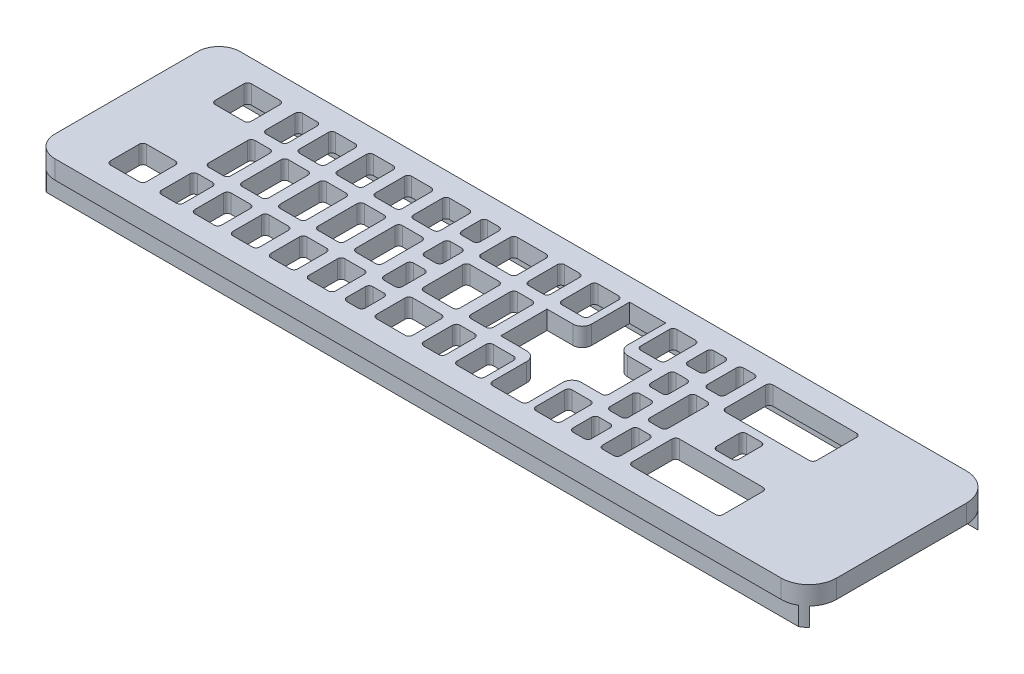
from build123d import *

# Parameters (mm, degrees)
SKETCH1_W               = 218.44
SKETCH1_H               = 50.8
BOSS_EXTRUDE1_DEPTH     = 5.08
SKETCH2_W               = 216.408
SKETCH2_H               = 48.768
BOSS_EXTRUDE2_DEPTH     = 5.08
SKETCH3_W               = 213.868
SKETCH3_H               = 46.228
CUT_EXTRUDE1_DEPTH      = 5.08
FILLET1_R               = 2.54
SKETCH4_W               = 9.906
SKETCH4_H               = 9.906
SKETCH4_W_2             = 6.096
SKETCH4_H_2             = 12.7
SKETCH4_W_3             = 7.366
SKETCH4_W_4             = 5.08
SKETCH4_H_3             = 7.112
SKETCH4_H_4             = 8.128
SKETCH4_W_5             = 7.62
SKETCH4_W_6             = 7.112
SKETCH4_W_7             = 5.0038
SKETCH4_H_5             = 6.828713061
SKETCH4_W_8             = 24.9174
SKETCH4_H_6             = 12.954
SKETCH4_H_7             = 8.141940284
CUT_EXTRUDE2_DEPTH      = 113.593934117
FILLET2_R               = 2.54
FILLET3_R               = 1.016
FILLET4_R               = 1.016
FILLET5_R               = 1.016
FILLET6_R               = 1.016
FILLET7_R               = 1.016
FILLET8_R               = 2.54
CUT_EXTRUDE7_DEPTH      = 113.249609353
CUT_EXTRUDE7_DEPTH_BACK = 113.249609353
SKETCH6_W               = 5.442052388
SKETCH6_H               = 50.8
FILLET11_R              = 7.62
CUT_EXTRUDE8_DEPTH      = 113.249609353
CUT_EXTRUDE8_DEPTH_BACK = 113.249609353
SKETCH7_W               = 1.016
SKETCH7_H               = 10.16
FILLET16_R              = 5.842


with BuildPart() as part:
    # Sketch1 → Boss-Extrude1 (new body)
    with BuildSketch(Plane(origin=(0, 0, 0), x_dir=(1, 0, 0), z_dir=(0, 1, 0))):
        Rectangle(SKETCH1_W, SKETCH1_H)
    extrude(amount=BOSS_EXTRUDE1_DEPTH)

    # Sketch2 → Boss-Extrude2 (add)
    with BuildSketch(Plane.XZ):
        Rectangle(SKETCH2_W, SKETCH2_H)
    extrude(amount=BOSS_EXTRUDE2_DEPTH)

    # Sketch3 → Cut-Extrude1 (cut)
    with BuildSketch(Plane.XZ.offset(5.08)):
        Rectangle(SKETCH3_W, SKETCH3_H)
    extrude(amount=-CUT_EXTRUDE1_DEPTH, mode=Mode.SUBTRACT)

    # Fillet1
    fillet1_edges = [part.edges().sort_by_distance(p)[0] for p in [
        (-108.204, -2.54, 24.384),
        (-108.204, -2.54, -24.384),
        (108.204, -2.54, 24.384),
        (106.934, -2.54, -23.114),
        (-109.22, 2.54, -25.4),
        (109.22, 2.54, -25.4),
        (109.22, 2.54, 25.4),
        (-109.22, 2.54, 25.4),
    ]]
    fillet(fillet1_edges, radius=FILLET1_R)

    # Sketch4 → Cut-Extrude2 (cut, through all)
    with BuildSketch(Plane(origin=(0, 5.08, 0), x_dir=(1, 0, 0), z_dir=(0, 1, 0))):
        with Locations((-89.281, -14.351)):
            Rectangle(SKETCH4_W, SKETCH4_H)
        with Locations((-89.281, 14.351)):
            Rectangle(SKETCH4_W, SKETCH4_H)
        with Locations((-77.216, 14.351)):
            Rectangle(SKETCH4_W_2, SKETCH4_H)
        with Locations((-77.216, 0)):
            Rectangle(SKETCH4_W_2, SKETCH4_H_2)
        with Locations((-77.216, -14.351)):
            Rectangle(SKETCH4_W_2, SKETCH4_H)
        with Locations((-67.437, -14.351)):
            Rectangle(SKETCH4_W_3, SKETCH4_H)
        with Locations((-67.437, 0)):
            Rectangle(SKETCH4_W_3, SKETCH4_H_2)
        with Locations((-67.437, 14.351)):
            Rectangle(SKETCH4_W_3, SKETCH4_H)
        with Locations((-57.023, 14.351)):
            Rectangle(SKETCH4_W_3, SKETCH4_H)
        with Locations((-57.023, 0)):
            Rectangle(SKETCH4_W_3, SKETCH4_H_2)
        with Locations((-57.023, -14.351)):
            Rectangle(SKETCH4_W_3, SKETCH4_H)
        with Locations((-46.609, 0)):
            Rectangle(SKETCH4_W_3, SKETCH4_H_2)
        with Locations((-46.609, 14.351)):
            Rectangle(SKETCH4_W_3, SKETCH4_H)
        with Locations((-46.609, -14.351)):
            Rectangle(SKETCH4_W_3, SKETCH4_H)
        with Locations((-36.195, -14.351)):
            Rectangle(SKETCH4_W_3, SKETCH4_H)
        with Locations((-36.195, 0)):
            Rectangle(SKETCH4_W_3, SKETCH4_H_2)
        with Locations((-36.195, 14.351)):
            Rectangle(SKETCH4_W_3, SKETCH4_H)
        with Locations((-26.924, 15.748)):
            Rectangle(SKETCH4_W_4, SKETCH4_H_3)
        with Locations((-26.924, 5.588)):
            Rectangle(SKETCH4_W_4, SKETCH4_H_3)
        with Locations((-26.924, -5.08)):
            Rectangle(SKETCH4_W_4, SKETCH4_H_4)
        with Locations((-26.924, -15.748)):
            Rectangle(SKETCH4_W_4, SKETCH4_H_3)
        with Locations((-16.383, 14.351)):
            Rectangle(SKETCH4_W, SKETCH4_H)
        with Locations((-5.334, 14.351)):
            Rectangle(SKETCH4_W_2, SKETCH4_H)
        with Locations((-16.383, 0)):
            Rectangle(SKETCH4_W, SKETCH4_H_2)
        with Locations((-5.334, 0)):
            Rectangle(SKETCH4_W_2, SKETCH4_H_2)
        with Locations((-16.383, -14.351)):
            Rectangle(SKETCH4_W, SKETCH4_H)
        with Locations((-5.334, -14.351)):
            Rectangle(SKETCH4_W_2, SKETCH4_H)
        with Locations((4.572, -14.351)):
            Rectangle(SKETCH4_W_5, SKETCH4_H)
        with BuildLine():
            Line((10.414, -6.35), (8.382, -6.35))
            Line((8.382, -6.35), (0.762, -6.35))
            Line((0.762, -6.35), (0.762, 6.35))
            Line((0.762, 6.35), (8.382, 6.35))
            Line((8.382, 6.35), (10.414, 6.35))
            Line((10.414, 6.35), (10.414, 19.304))
            Line((10.414, 19.304), (20.32, 19.304))
            Line((20.32, 19.304), (20.32, 8.89))
            ThreePointArc((20.32, 8.89), (21.063948776, 7.093948776), (22.86, 6.35))
            Line((22.86, 6.35), (29.464, 6.35))
            Line((29.464, 6.35), (29.464, -6.35))
            Line((29.464, -6.35), (22.86, -6.35))
            ThreePointArc((22.86, -6.35), (21.063948776, -7.093948776), (20.32, -8.89))
            Line((20.32, -8.89), (20.32, -19.304))
            Line((20.32, -19.304), (10.414, -19.304))
            Line((10.414, -19.304), (10.414, -6.35))
        make_face()
        with Locations((4.572, 14.351)):
            Rectangle(SKETCH4_W_5, SKETCH4_H)
        with Locations((25.908, 14.351)):
            Rectangle(SKETCH4_W_6, SKETCH4_H)
        with Locations((35.052, 15.748)):
            Rectangle(SKETCH4_W_4, SKETCH4_H_3)
        with Locations((43.1419, 14.351)):
            Rectangle(SKETCH4_W_7, SKETCH4_H)
        with Locations((43.1419, 0)):
            Rectangle(SKETCH4_W_7, SKETCH4_H_2)
        with Locations((35.052, -5.08)):
            Rectangle(SKETCH4_W_4, SKETCH4_H_4)
        with Locations((35.052, 5.446356531)):
            Rectangle(SKETCH4_W_4, SKETCH4_H_5)
        with Locations((25.908, -14.351)):
            Rectangle(SKETCH4_W_6, SKETCH4_H)
        with Locations((35.052, -15.748)):
            Rectangle(SKETCH4_W_4, SKETCH4_H_3)
        with Locations((43.1419, -14.351)):
            Rectangle(SKETCH4_W_7, SKETCH4_H)
        with Locations((61.1505, -12.827)):
            Rectangle(SKETCH4_W_8, SKETCH4_H_6)
        with Locations((59.6138, 0.08685337)):
            Rectangle(SKETCH4_W_2, SKETCH4_H_7)
        with Locations((61.1505, 12.827)):
            Rectangle(SKETCH4_W_8, SKETCH4_H_6)
    extrude(amount=-CUT_EXTRUDE2_DEPTH, mode=Mode.SUBTRACT)

    # Fillet2
    fillet2_edges = [part.edges().sort_by_distance(p)[0] for p in [
        (10.414, 2.54, 6.35),
        (10.414, 2.54, -6.35),
    ]]
    fillet(fillet2_edges, radius=FILLET2_R)

    # Fillet3
    fillet3_edges = [part.edges().sort_by_distance(p)[0] for p in [
        (48.6918, 2.54, -19.304),
        (73.6092, 2.54, -19.304),
        (73.6092, 2.54, -6.35),
        (48.6918, 2.54, -6.35),
        (48.6918, 2.54, 19.304),
        (48.6918, 2.54, 6.35),
        (73.6092, 2.54, 6.35),
        (73.6092, 2.54, 19.304),
        (56.5658, 2.54, -4.157823512),
        (62.6618, 2.54, -4.157823512),
        (62.6618, 2.54, 3.984116772),
        (56.5658, 2.54, 3.984116772),
    ]]
    fillet(fillet3_edges, radius=FILLET3_R)

    # Fillet4
    fillet4_edges = [part.edges().sort_by_distance(p)[0] for p in [
        (-53.34, 2.54, 6.35),
        (-53.34, 2.54, 19.304),
        (-42.926, 2.54, 6.35),
        (-42.926, 2.54, -9.398),
        (-42.926, 2.54, 19.304),
        (-32.512, 2.54, 19.304),
        (-32.512, 2.54, 6.35),
        (-32.512, 2.54, -9.398),
        (-53.34, 2.54, -9.398),
        (-63.754, 2.54, -9.398),
        (-63.754, 2.54, 6.35),
        (-63.754, 2.54, 19.304),
        (-74.168, 2.54, 19.304),
        (-74.168, 2.54, 6.35),
        (-74.168, 2.54, -9.398),
        (-84.328, 2.54, -9.398),
        (-11.43, 2.54, 19.304),
        (-2.286, 2.54, 19.304),
        (29.464, 2.54, 6.35),
        (20.32, 2.54, 19.304),
        (8.382, 2.54, 19.304),
        (8.382, 2.54, -9.398),
        (29.464, 2.54, -9.398),
        (37.592, 2.54, -12.192),
        (45.6438, 2.54, -9.398),
        (-2.286, 2.54, 6.35),
        (-11.43, 2.54, 6.35),
        (-2.286, 2.54, -9.398),
        (-11.43, 2.54, -9.398),
        (-24.384, 2.54, 19.304),
        (-24.384, 2.54, 9.144),
        (-24.384, 2.54, -2.032),
        (-24.384, 2.54, -12.192),
        (29.464, 2.54, 19.304),
        (37.592, 2.54, -2.032),
        (37.592, 2.54, 9.144),
        (45.6438, 2.54, 6.35),
        (37.592, 2.54, 19.304),
        (45.6438, 2.54, 19.304),
        (-84.328, 2.54, 19.304),
    ]]
    fillet(fillet4_edges, radius=FILLET4_R)

    # Fillet5
    fillet5_edges = [part.edges().sort_by_distance(p)[0] for p in [
        (-53.34, 2.54, -6.35),
        (-53.34, 2.54, 9.398),
        (-42.926, 2.54, -6.35),
        (-42.926, 2.54, -19.304),
        (-42.926, 2.54, 9.398),
        (-32.512, 2.54, 9.398),
        (-32.512, 2.54, -6.35),
        (-32.512, 2.54, -19.304),
        (-53.34, 2.54, -19.304),
        (-63.754, 2.54, -19.304),
        (-63.754, 2.54, -6.35),
        (-63.754, 2.54, 9.398),
        (-74.168, 2.54, 9.398),
        (-74.168, 2.54, -6.35),
        (-74.168, 2.54, -19.304),
        (-84.328, 2.54, -19.304),
        (-11.43, 2.54, 9.398),
        (-2.286, 2.54, 9.398),
        (8.382, 2.54, 9.398),
        (8.382, 2.54, -19.304),
        (29.464, 2.54, -19.304),
        (37.592, 2.54, -19.304),
        (45.6438, 2.54, -19.304),
        (-2.286, 2.54, -6.35),
        (-11.43, 2.54, -6.35),
        (-2.286, 2.54, -19.304),
        (-11.43, 2.54, -19.304),
        (-24.384, 2.54, 12.192),
        (-24.384, 2.54, 1.016),
        (-24.384, 2.54, -9.144),
        (-24.384, 2.54, -19.304),
        (29.464, 2.54, 9.398),
        (37.592, 2.54, -8.860713061),
        (37.592, 2.54, 1.016),
        (45.6438, 2.54, -6.35),
        (37.592, 2.54, 12.192),
        (45.6438, 2.54, 9.398),
        (-84.328, 2.54, 9.398),
    ]]
    fillet(fillet5_edges, radius=FILLET5_R)

    # Fillet6
    fillet6_edges = [part.edges().sort_by_distance(p)[0] for p in [
        (-60.706, 2.54, 6.35),
        (-60.706, 2.54, 19.304),
        (-50.292, 2.54, 6.35),
        (-50.292, 2.54, -9.398),
        (-50.292, 2.54, 19.304),
        (-39.878, 2.54, 19.304),
        (-39.878, 2.54, 6.35),
        (-39.878, 2.54, -9.398),
        (-60.706, 2.54, -9.398),
        (-71.12, 2.54, -9.398),
        (-71.12, 2.54, 6.35),
        (-71.12, 2.54, 19.304),
        (-80.264, 2.54, 19.304),
        (-80.264, 2.54, 6.35),
        (-80.264, 2.54, -9.398),
        (-94.234, 2.54, -9.398),
        (-21.336, 2.54, 19.304),
        (-8.382, 2.54, 19.304),
        (10.414, 2.54, 19.304),
        (0.762, 2.54, 19.304),
        (0.762, 2.54, -9.398),
        (22.352, 2.54, -9.398),
        (32.512, 2.54, -12.192),
        (40.64, 2.54, -9.398),
        (-8.382, 2.54, 6.35),
        (-21.336, 2.54, 6.35),
        (-8.382, 2.54, -9.398),
        (-21.336, 2.54, -9.398),
        (-29.464, 2.54, 19.304),
        (-29.464, 2.54, 9.144),
        (-29.464, 2.54, -2.032),
        (-29.464, 2.54, -12.192),
        (22.352, 2.54, 19.304),
        (32.512, 2.54, -2.032),
        (32.512, 2.54, 9.144),
        (40.64, 2.54, 6.35),
        (32.512, 2.54, 19.304),
        (40.64, 2.54, 19.304),
        (-94.234, 2.54, 19.304),
    ]]
    fillet(fillet6_edges, radius=FILLET6_R)

    # Fillet7
    fillet7_edges = [part.edges().sort_by_distance(p)[0] for p in [
        (-60.706, 2.54, -6.35),
        (-60.706, 2.54, 9.398),
        (-50.292, 2.54, -6.35),
        (-50.292, 2.54, -19.304),
        (-50.292, 2.54, 9.398),
        (-39.878, 2.54, 9.398),
        (-39.878, 2.54, -6.35),
        (-39.878, 2.54, -19.304),
        (-60.706, 2.54, -19.304),
        (-71.12, 2.54, -19.304),
        (-71.12, 2.54, -6.35),
        (-71.12, 2.54, 9.398),
        (-80.264, 2.54, 9.398),
        (-80.264, 2.54, -6.35),
        (-80.264, 2.54, -19.304),
        (-94.234, 2.54, -19.304),
        (-21.336, 2.54, 9.398),
        (-8.382, 2.54, 9.398),
        (0.762, 2.54, 9.398),
        (0.762, 2.54, -19.304),
        (22.352, 2.54, -19.304),
        (32.512, 2.54, -19.304),
        (40.64, 2.54, -19.304),
        (-8.382, 2.54, -6.35),
        (-21.336, 2.54, -6.35),
        (-8.382, 2.54, -19.304),
        (-21.336, 2.54, -19.304),
        (-29.464, 2.54, 12.192),
        (-29.464, 2.54, 1.016),
        (-29.464, 2.54, -9.144),
        (-29.464, 2.54, -19.304),
        (22.352, 2.54, 9.398),
        (32.512, 2.54, -8.860713061),
        (32.512, 2.54, 1.016),
        (40.64, 2.54, -6.35),
        (32.512, 2.54, 12.192),
        (40.64, 2.54, 9.398),
        (-94.234, 2.54, 9.398),
    ]]
    fillet(fillet7_edges, radius=FILLET7_R)

    # Fillet8
    fillet8_edges = [part.edges().sort_by_distance(p)[0] for p in [
        (108.204, -2.54, -24.384),
        (-106.934, -2.54, -23.114),
        (-106.934, -2.54, 23.114),
        (106.934, -2.54, 23.114),
    ]]
    fillet(fillet8_edges, radius=FILLET8_R)

    # Sketch6 → Cut-Extrude7 (cut, two sides: drawn at the far end of the back side and taken through both)
    with BuildSketch(Plane(origin=(0, 0, 0), x_dir=(1, 0, 0), z_dir=(0, 1, 0)).offset(-CUT_EXTRUDE7_DEPTH_BACK)):
        with Locations((106.968468832, 0)):
            Rectangle(SKETCH6_W, SKETCH6_H)
    extrude(amount=CUT_EXTRUDE7_DEPTH + CUT_EXTRUDE7_DEPTH_BACK, mode=Mode.SUBTRACT)

    # Fillet11
    fillet11_edges = [part.edges().sort_by_distance(p)[0] for p in [
        (104.247442638, 2.54, -25.4),
        (104.247442638, 2.54, 25.4),
    ]]
    fillet(fillet11_edges, radius=FILLET11_R)

    # Sketch7 → Cut-Extrude8 (cut, two sides: drawn at the far end of the back side and taken through both)
    with BuildSketch(Plane.XY.offset(-CUT_EXTRUDE8_DEPTH_BACK)):
        with Locations((-108.712, 0)):
            Rectangle(SKETCH7_W, SKETCH7_H)
    extrude(amount=CUT_EXTRUDE8_DEPTH + CUT_EXTRUDE8_DEPTH_BACK, mode=Mode.SUBTRACT)

    # Fillet16
    # the kernel refuses this fillet: 5.842 mm, written as the material it takes off along each edge
    with BuildSketch(Plane(origin=(-108.204, -14.660113403, -24.892), x_dir=(0, 0, 1), z_dir=(0, 1, 0))) as fillet16_piece_1:
        with BuildLine():
            CenterArc((5.334, 5.842), FILLET16_R, 180, 90)
            Line((-0.508, 5.842), (-1.0922, 5.842))
            ThreePointArc((-1.0922, 5.842), (-1.0922, 1.524), (-0.46736, -0.35052))
            Line((-0.46736, -0.35052), (0, -0.5842))
            Line((0, -0.5842), (5.334, -0.5842))
            Line((5.334, -0.5842), (5.334, 0))
        make_face()
    extrude(amount=34.400226807, mode=Mode.SUBTRACT)
    with BuildSketch(Plane(origin=(-108.204, -14.660113403, 24.892), x_dir=(0, 0, -1), z_dir=(0, 1, 0))) as fillet16_piece_2:
        with BuildLine():
            CenterArc((5.334, -5.842), FILLET16_R, 90, 90)
            Line((-0.508, -5.842), (-1.0922, -5.842))
            ThreePointArc((-1.0922, -5.842), (-1.0922, -1.524), (-0.46736, 0.35052))
            Line((-0.46736, 0.35052), (0, 0.5842))
            Line((0, 0.5842), (5.334, 0.5842))
            Line((5.334, 0.5842), (5.334, 0))
        make_face()
    extrude(amount=34.400226807, mode=Mode.SUBTRACT)


solid = part.part
